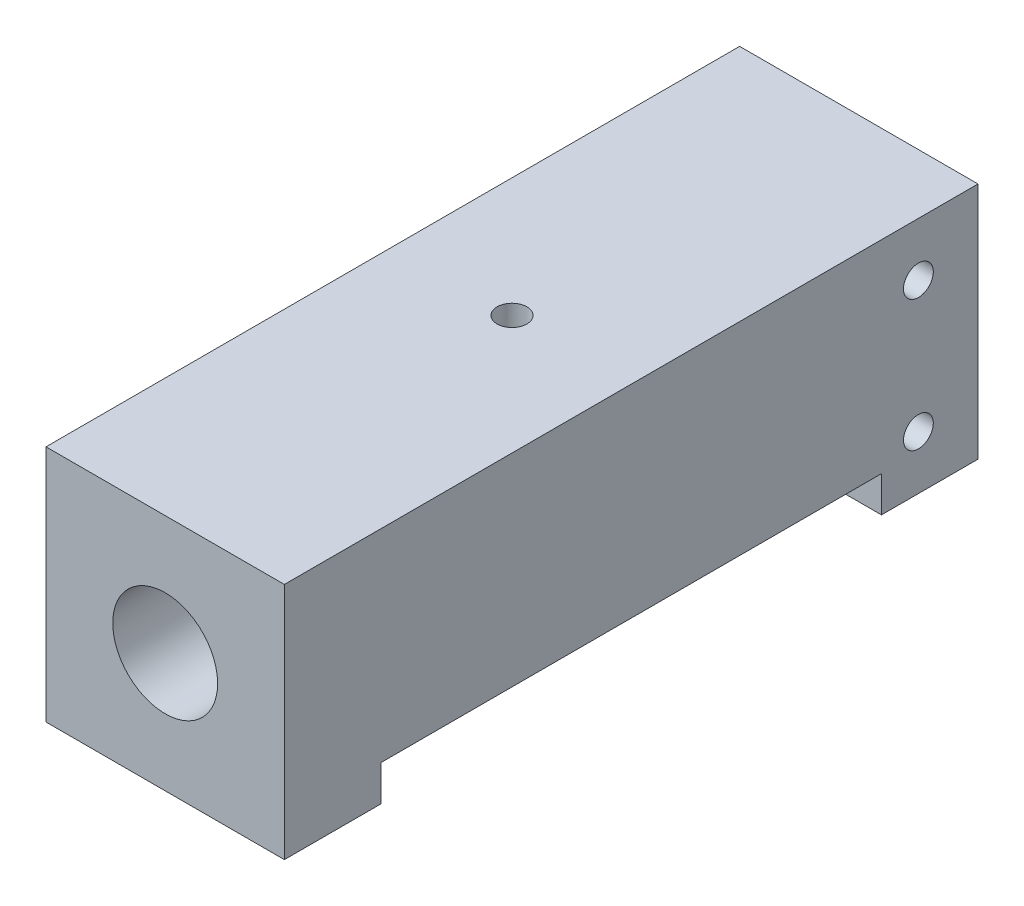
from build123d import *

# Parameters (mm, degrees)
SCHIZZO1_W                   = 20
SCHIZZO1_H                   = 20
ESTRUSIONE_ESTRUSIONE1_DEPTH = 58.2
SCHIZZO2_R                   = 3
TAGLIO_ESTRUSIONE1_DEPTH     = 60.893572276
FORO_FILETTATO_G1_8_1_D      = 8.8
FORO_FILETTATO_G1_8_1_DEPTH  = 10
FORO_FILETTATO_G1_8_1_TIP    = 2.643786724
M3_TAPPED_HOLE2_D            = 2.5
M3_TAPPED_HOLE2_DEPTH        = 5
M3_TAPPED_HOLE2_TIP          = 0.751075774
M3_TAPPED_HOLE3_D            = 2.5
SKETCH1_W                    = 36.2
SKETCH1_H                    = 6
BOSS_EXTRUDE1_DEPTH          = 4.9
CUT_EXTRUDE1_DEPTH           = 65.087830449
M3_TAPPED_HOLE4_D            = 2.5
M3_TAPPED_HOLE4_DEPTH        = 20
M3_TAPPED_HOLE4_TIP          = 0.751075774


with BuildPart() as part:
    # Schizzo1 → Estrusione-Estrusione1 (new body)
    with BuildSketch(Plane.XY):
        Rectangle(SCHIZZO1_W, SCHIZZO1_H)
    extrude(amount=-ESTRUSIONE_ESTRUSIONE1_DEPTH)

    # Schizzo2 → Taglio-Estrusione1 (cut, through all)
    with BuildSketch(Plane(origin=(0, 0, -58.2), x_dir=(-1, 0, 0), z_dir=(0, 0, -1))):
        Circle(SCHIZZO2_R)
    extrude(amount=-TAGLIO_ESTRUSIONE1_DEPTH, mode=Mode.SUBTRACT)

    # Foro filettato G1/8-1
    with Locations(Plane.XY):
        with Locations((0, 0)):
            Hole(FORO_FILETTATO_G1_8_1_D / 2, depth=FORO_FILETTATO_G1_8_1_DEPTH)
            with Locations((0, 0, -(FORO_FILETTATO_G1_8_1_DEPTH + FORO_FILETTATO_G1_8_1_TIP / 2))):  # 118° drill point
                Cone(0, FORO_FILETTATO_G1_8_1_D / 2, FORO_FILETTATO_G1_8_1_TIP, mode=Mode.SUBTRACT)

    # M3 Tapped Hole2
    with Locations(Plane(origin=(0, 10, -29.1), x_dir=(1, 0, 0), z_dir=(0, 1, 0))):
        with Locations((0, 0)):
            Hole(M3_TAPPED_HOLE2_D / 2, depth=M3_TAPPED_HOLE2_DEPTH)
            with Locations((0, 0, -(M3_TAPPED_HOLE2_DEPTH + M3_TAPPED_HOLE2_TIP / 2))):  # 118° drill point
                Cone(0, M3_TAPPED_HOLE2_D / 2, M3_TAPPED_HOLE2_TIP, mode=Mode.SUBTRACT)

    # Schizzo14 → Foro Ø16.0 (16)-1 (revolve, cut)
    with BuildSketch(Plane(origin=(0, 0, -58.2), x_dir=(0, 1, 0), z_dir=(1, 0, 0))):
        Polygon((0, 0), (0, 16.806884952), (8, 12), (8, 0), align=None)
    revolve(axis=Axis((0, 0, -64.55), (0, 0, 1)), mode=Mode.SUBTRACT)

    # M3 Tapped Hole3 (through all)
    with Locations(Plane(origin=(10, 5.5, -53.2), x_dir=(0, 0, 1), z_dir=(1, 0, 0))):
        with Locations((0, 0), (0, 11)):
            Hole(M3_TAPPED_HOLE3_D / 2)

    # Sketch1 → Boss-Extrude1 (add)
    with BuildSketch(Plane.ZY.offset(10)):
        with Locations((-40.1, 0)):
            Rectangle(SKETCH1_W, SKETCH1_H)
    extrude(amount=BOSS_EXTRUDE1_DEPTH)

    # Sketch2 → Cut-Extrude1 (cut, through all)
    with BuildSketch(Plane(origin=(10, 0, 0), x_dir=(0, 0, -1), z_dir=(1, 0, 0))):
        Polygon((50.1, -10), (34.1, -10), (8.1, -10), (8.1, -7), (34.1, -7), (50.1, -7), align=None)
    extrude(amount=-CUT_EXTRUDE1_DEPTH, mode=Mode.SUBTRACT)

    # M3 Tapped Hole4
    with Locations(Plane.XY.offset(-22)):
        with Locations((-13, 0)):
            Hole(M3_TAPPED_HOLE4_D / 2, depth=M3_TAPPED_HOLE4_DEPTH)
            with Locations((0, 0, -(M3_TAPPED_HOLE4_DEPTH + M3_TAPPED_HOLE4_TIP / 2))):  # 118° drill point
                Cone(0, M3_TAPPED_HOLE4_D / 2, M3_TAPPED_HOLE4_TIP, mode=Mode.SUBTRACT)


solid = part.part
